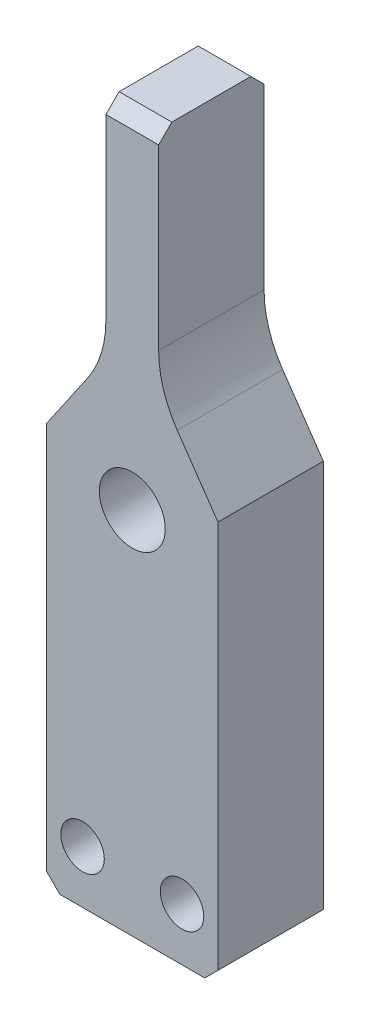
from build123d import *

# Parameters (mm, degrees)
ESQUISSE1_W                             = 13
ESQUISSE1_H                             = 55
BOSS_EXTRU_1_DEPTH                      = 8
TROUS_DE_CENTRAGE_5_0MMTRANSITIONAL_1_D = 5
ESQUISSE4_W                             = 4.5
ESQUISSE4_H                             = 20
ENL_V_MAT_EXTRU_1_DEPTH                 = 30.368350311
CONG_1_R                                = 2
CHANFREIN1_SIZE                         = 1
TROU_TARAUD_M41_D                       = 3.3
CHANFREIN2_START                        = -1
CHANFREIN2_DEPTH                        = 10
ESQUISSE9_W                             = 8
ESQUISSE9_H                             = 8
ENL_V_MAT_EXTRU_2_DEPTH                 = 30.874738493
ESQUISSE10_W                            = 4
ESQUISSE10_H                            = 8
BOSS_EXTRU_2_DEPTH                      = 7
CHANFREIN3_SIZE                         = 1
BOSS_EXTRU_3_START                      = -8
BOSS_EXTRU_3_DEPTH                      = 8
CONG_2_R                                = 8


with BuildPart() as part:
    # Esquisse1 → Boss.-Extru.1 (new body)
    with BuildSketch(Plane.XY):
        Rectangle(ESQUISSE1_W, ESQUISSE1_H)
    extrude(amount=BOSS_EXTRU_1_DEPTH)

    # Trous de centrage Ø5.0mmTransitional 1 (through all)
    with Locations(Plane.XY.offset(8)):
        with Locations((0, 0.5)):
            Hole(TROUS_DE_CENTRAGE_5_0MMTRANSITIONAL_1_D / 2)

    # Esquisse4 → Enlèv. mat.-Extru.1 (cut, through all)
    with BuildSketch(Plane.XY.offset(8)):
        with Locations((4.25, 17.5)):
            Rectangle(ESQUISSE4_W, ESQUISSE4_H)
        with Locations((-4.25, 17.5)):
            Rectangle(ESQUISSE4_W, ESQUISSE4_H)
    extrude(amount=-ENL_V_MAT_EXTRU_1_DEPTH, mode=Mode.SUBTRACT)

    # Congé1
    cong_1_edges = [part.edges().sort_by_distance(p)[0] for p in [
        (2, 7.5, 4),
        (-2, 7.5, 4),
    ]]
    fillet(cong_1_edges, radius=CONG_1_R)

    # Chanfrein1
    chanfrein1_edges = [part.edges().sort_by_distance(p)[0] for p in [
        (6.5, -27.5, 4),
        (-6.5, -27.5, 4),
    ]]
    chamfer(chanfrein1_edges, length=CHANFREIN1_SIZE)

    # Trou taraudé M41 (through all)
    with Locations(Plane.XY.offset(8)):
        with Locations((-3.775, -23.5), (3.775, -23.5)):
            Hole(TROU_TARAUD_M41_D / 2)

    # Chanfrein2: read off the stored shape, not the designer's step
    # Chanfrein2 outline → Chanfrein2 (cut)
    with BuildSketch(Plane.XY.offset(CHANFREIN2_START)):
        with BuildLine():
            Line((3.285714286, 7.631900453), (6.5, 2.961651585))
            Line((6.5, 2.961651585), (6.5, 7.5))
            Line((6.5, 7.5), (4, 7.5))
            ThreePointArc((4, 7.5), (3.636818981, 7.533251529), (3.285714286, 7.631900453))
        make_face()
        with BuildLine():
            Line((-6.5, 2.961651585), (-3.285714286, 7.631900453))
            ThreePointArc((-3.285714286, 7.631900453), (-3.636818981, 7.533251529), (-4, 7.5))
            Line((-4, 7.5), (-6.5, 7.5))
            Line((-6.5, 7.5), (-6.5, 2.961651585))
        make_face()
    extrude(amount=CHANFREIN2_DEPTH, mode=Mode.SUBTRACT)

    # Esquisse9 → Enlèv. mat.-Extru.2 (cut, through all)
    with BuildSketch(Plane.ZY.offset(2)):
        with Locations((4, 23.5)):
            Rectangle(ESQUISSE9_W, ESQUISSE9_H)
    extrude(amount=-ENL_V_MAT_EXTRU_2_DEPTH, mode=Mode.SUBTRACT)

    # Esquisse10 → Boss.-Extru.2 (add)
    with BuildSketch(Plane(origin=(0, 19.5, 0), x_dir=(1, 0, 0), z_dir=(0, 1, 0))):
        with Locations((0, -4)):
            Rectangle(ESQUISSE10_W, ESQUISSE10_H)
    extrude(amount=BOSS_EXTRU_2_DEPTH)

    # Chanfrein3
    chanfrein3_edges = [part.edges().sort_by_distance(p)[0] for p in [
        (0, 26.5, 0),
        (0, 26.5, 8),
    ]]
    chamfer(chanfrein3_edges, length=CHANFREIN3_SIZE)

    # Esquisse11 → Boss.-Extru.3 (add)
    with BuildSketch(Plane.XY.offset(8).offset(BOSS_EXTRU_3_START)):
        with BuildLine():
            Line((-3.285714286, 7.631900453), (-2, 9.5))
            ThreePointArc((-2, 9.5), (-2.352491058, 8.366106581), (-3.285714286, 7.631900453))
        make_face()
        with BuildLine():
            Line((3.285714286, 7.631900453), (2, 9.5))
            ThreePointArc((2, 9.5), (2.352491058, 8.366106581), (3.285714286, 7.631900453))
        make_face()
    extrude(amount=BOSS_EXTRU_3_DEPTH)

    # Congé2
    cong_2_edges = [part.edges().sort_by_distance(p)[0] for p in [
        (-2, 9.5, 4),
        (2, 9.5, 4),
    ]]
    fillet(cong_2_edges, radius=CONG_2_R)


solid = part.part
